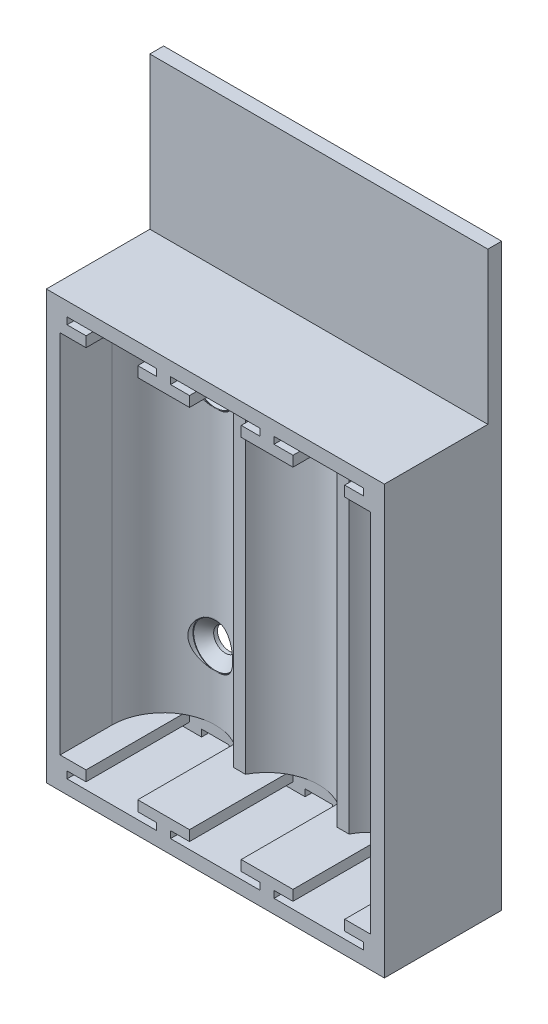
from build123d import *

# Parameters (mm, degrees)
SKETCH_1_W                 = 15
SKETCH_1_H                 = 17
EXTRUDE_1_DEPTH            = 2
EXTRUDE_2_DEPTH            = 1
EXTRUDE_3_DEPTH            = 1.5
EXTRUDE_4_DEPTH            = 53
EXTRUDE_5_DEPTH            = 1.5
EXTRUDE_6_DEPTH            = 1
SKETCH_8_W                 = 15
SKETCH_8_H                 = 17
EXTRUDE_7_DEPTH            = 2
SKETCH_13_W                = 4
SKETCH_13_H                = 1
CUT_EXTRUDE_1_DEPTH        = 65.228109111
PATTERN_LINEAR_1_COUNT     = 3
PATTERN_LINEAR_1_PITCH     = 15
SKETCH_14_W                = 17
SKETCH_14_H                = 62
EXTRUDE_8_DEPTH            = 2
SKETCH_15_W                = 17
SKETCH_15_H                = 62
EXTRUDE_9_DEPTH            = 2
SKETCH_22_W                = 7.5
SKETCH_22_H                = 11
CUT_EXTRUDE_2_DEPTH        = 53
SKETCH_24_R                = 3.25
CUT_EXTRUDE_3_DEPTH        = 76.028327984
HOLE_WIZARD_M36_AT_2_COUNT = 2
HOLE_WIZARD_M36_AT_2_PITCH = 33
HOLE_WIZARD_M36_AT_3_COUNT = 2
HOLE_WIZARD_M36_AT_3_PITCH = 30
HOLE_WIZARD_M36_AT_4_COUNT = 2
HOLE_WIZARD_M36_AT_4_PITCH = 44.598206242
SKETCH_39_W                = 49
SKETCH_39_H                = 2
EXTRUDE_10_DEPTH           = 22


with BuildPart() as part:
    # Эскиз1 → Бобышка-Вытянуть1 (new body)
    with BuildSketch(Plane(origin=(0, 0, 0), x_dir=(1, 0, 0), z_dir=(0, 1, 0))):
        with Locations((0, -8.5)):
            Rectangle(SKETCH_1_W, SKETCH_1_H)
    extrude(amount=-EXTRUDE_1_DEPTH)

    # Эскиз2 → Бобышка-Вытянуть2 (add)
    with BuildSketch(Plane.XZ.offset(2)):
        Polygon((-7.5, 17), (-6.5, 17), (-6.5, 2), (6.5, 2), (6.5, 17), (7.5, 17), (7.5, 0), (-7.5, 0), align=None)
    extrude(amount=EXTRUDE_2_DEPTH)

    # Эскиз3 → Бобышка-Вытянуть3 (add)
    with BuildSketch(Plane.XZ.offset(3)):
        Polygon((-7.5, 17), (-3.75, 17), (-3.75, 2), (3.75, 2), (3.75, 17), (7.5, 17), (7.5, 0), (-7.5, 0), align=None)
    extrude(amount=EXTRUDE_3_DEPTH)

    # Эскиз4 → Бобышка-Вытянуть4 (add)
    with BuildSketch(Plane.XZ.offset(4.5)):
        with BuildLine():
            ThreePointArc((7.5, 9.5), (0, 2), (-7.5, 9.5))
            Line((-7.5, 9.5), (-7.5, 0))
            Line((-7.5, 0), (7.5, 0))
            Line((7.5, 0), (7.5, 9.5))
        make_face()
    extrude(amount=EXTRUDE_4_DEPTH)

    # Эскиз6 → Бобышка-Вытянуть5 (add)
    with BuildSketch(Plane.XZ.offset(57.5)):
        Polygon((-7.5, 0), (-7.5, 17), (-3.75, 17), (-3.75, 2), (3.75, 2), (3.75, 17), (7.5, 17), (7.5, 0), align=None)
    extrude(amount=EXTRUDE_5_DEPTH)

    # Эскиз7 → Бобышка-Вытянуть6 (add)
    with BuildSketch(Plane.XZ.offset(59)):
        Polygon((-6.5, 17), (-7.5, 17), (-7.5, 0), (7.5, 0), (7.5, 17), (6.5, 17), (6.5, 2), (-6.5, 2), align=None)
    extrude(amount=EXTRUDE_6_DEPTH)

    # Эскиз8 → Бобышка-Вытянуть7 (add)
    with BuildSketch(Plane.XZ.offset(60)):
        with Locations((0, 8.5)):
            Rectangle(SKETCH_8_W, SKETCH_8_H)
    extrude(amount=EXTRUDE_7_DEPTH)

    # Эскиз13 → Вырез-Вытянуть1 (cut, through all)
    with BuildSketch(Plane.XY.offset(2)):
        with Locations((0, -2.5)):
            Rectangle(SKETCH_13_W, SKETCH_13_H)
        with Locations((0, -59.5)):
            Rectangle(SKETCH_13_W, SKETCH_13_H)
    extrude(amount=-CUT_EXTRUDE_1_DEPTH, mode=Mode.SUBTRACT)


with BuildPart() as pattern_linear_1_1:
    # Линейный массив1: pattern copy
    add(part.part.moved(Location(Vector(1, 0, 0) * (1 * PATTERN_LINEAR_1_PITCH))))


with BuildPart() as pattern_linear_1_2:
    # Линейный массив1: pattern copy
    add(part.part.moved(Location(Vector(1, 0, 0) * (2 * PATTERN_LINEAR_1_PITCH))))

    # Эскиз14 → Бобышка-Вытянуть8 (add)
    with BuildSketch(Plane(origin=(37.5, 0, 0), x_dir=(0, 0, -1), z_dir=(1, 0, 0))):
        with Locations((-8.5, -31)):
            Rectangle(SKETCH_14_W, SKETCH_14_H)
    extrude(amount=EXTRUDE_8_DEPTH)


with BuildPart() as part_1:
    add(part.part)

    # Эскиз15 → Бобышка-Вытянуть9 (add)
    with BuildSketch(Plane.ZY.offset(7.5)):
        with Locations((8.5, -31)):
            Rectangle(SKETCH_15_W, SKETCH_15_H)
    extrude(amount=EXTRUDE_9_DEPTH)

    # Combine 1: read off the stored shape, not the designer's step
    # Combine 1: union Линейный массив1_2, Линейный массив1_1
    add(pattern_linear_1_2.part)
    add(pattern_linear_1_1.part)

    # Эскиз22 → Вырез-Вытянуть2 (cut)
    with BuildSketch(Plane.XZ.offset(4.5)):
        with Locations((22.5, 11.5)):
            Rectangle(SKETCH_22_W, SKETCH_22_H)
        with Locations((7.5, 11.5)):
            Rectangle(SKETCH_22_W, SKETCH_22_H)
    extrude(amount=CUT_EXTRUDE_2_DEPTH, mode=Mode.SUBTRACT)

    # Эскиз24 → Вырез-Вытянуть3 (cut, through all)
    with BuildSketch(Plane.XY.offset(2)):
        with Locations((0, -14.5)):
            Circle(SKETCH_24_R)
        with Locations((0, -47.5)):
            Circle(SKETCH_24_R)
        with Locations((30, -47.5)):
            Circle(SKETCH_24_R)
        with Locations((30, -14.5)):
            Circle(SKETCH_24_R)
    extrude(amount=CUT_EXTRUDE_3_DEPTH, mode=Mode.SUBTRACT)

    # Эскиз37 → Зенковка для винта с полупотайной головкой M36 (revolve, cut)
    with BuildSketch(Plane(origin=(0, -14.5, 2), x_dir=(0, -1, 0), z_dir=(1, 0, 0))):
        Polygon((0, 0), (0, 2), (1.7, 2), (1.7, 1.45), (3.15, 0), align=None)
    hole_wizard_m36 = revolve(axis=Axis((0, -14.5, 8.35), (0, 0, -1)), mode=Mode.SUBTRACT)

    # Зенковка для винта с полупотайной головкой M36 at 2: Зенковка для винта с полупотайной головкой M36 ×2
    with Locations(*[(0, -i * HOLE_WIZARD_M36_AT_2_PITCH, 0) for i in range(1, HOLE_WIZARD_M36_AT_2_COUNT)]):
        add(hole_wizard_m36, mode=Mode.SUBTRACT)

    # Зенковка для винта с полупотайной головкой M36 at 3: Зенковка для винта с полупотайной головкой M36 ×2
    with Locations(*[(i * HOLE_WIZARD_M36_AT_3_PITCH, 0, 0) for i in range(1, HOLE_WIZARD_M36_AT_3_COUNT)]):
        add(hole_wizard_m36, mode=Mode.SUBTRACT)

    # Зенковка для винта с полупотайной головкой M36 at 4: Зенковка для винта с полупотайной головкой M36 ×2
    with Locations(*[Vector(0.6726727939963126, -0.7399400733959436, 0) * (i * HOLE_WIZARD_M36_AT_4_PITCH) for i in range(1, HOLE_WIZARD_M36_AT_4_COUNT)]):
        add(hole_wizard_m36, mode=Mode.SUBTRACT)

    # Эскиз39 → Бобышка-Вытянуть10 (add)
    with BuildSketch(Plane(origin=(0, 0, 0), x_dir=(1, 0, 0), z_dir=(0, 1, 0))):
        with Locations((15, -1)):
            Rectangle(SKETCH_39_W, SKETCH_39_H)
    extrude(amount=EXTRUDE_10_DEPTH)


solid = part_1.part
